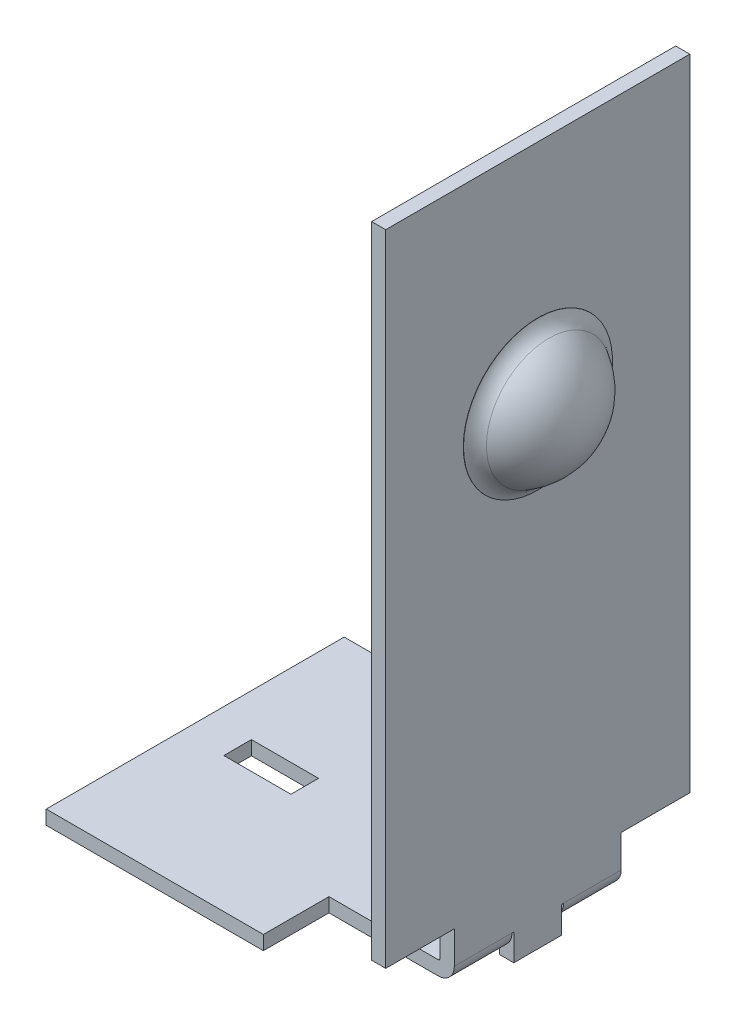
from build123d import *
from build123d.topology import SkipClean

# Parameters (mm, degrees)
Y_KSEKLIK_EKSTR_ZYON1_DEPTH = 3.24
IZIM2_W                     = 1.429951724
IZIM2_H                     = 0.588312172
KES_EKSTR_ZYON1_DEPTH       = 1.04186858
KES_EKSTR_ZYON2_DEPTH       = 0.5
Y_KSEKLIK_EKSTR_ZYON2_DEPTH = 0.3
IZIM7_R                     = 1.580293975
KES_EKSTR_ZYON3_DEPTH       = 0.3


with BuildPart() as part:
    # Çizim1 → Yükseklik-Ekstrüzyon1 (new, symmetric)
    with BuildSketch(Plane.XY):
        with BuildLine():
            Line((-0.3, 0.35), (-0.3, 14.676))
            Line((-0.3, 14.676), (0, 14.676))
            Line((0, 14.676), (0, 0.35))
            ThreePointArc((0, 0.35), (-0.102512627, 0.102512627), (-0.35, 0))
            Line((-0.35, 0), (-7.3, 0))
            Line((-7.3, 0), (-7.3, 0.3))
            Line((-7.3, 0.3), (-0.35, 0.3))
            ThreePointArc((-0.35, 0.3), (-0.314644661, 0.314644661), (-0.3, 0.35))
        make_face()
    extrude(amount=Y_KSEKLIK_EKSTR_ZYON1_DEPTH, both=True)

    # Çizim2 → Kes-Ekstrüzyon1 (cut)
    with BuildSketch(Plane(origin=(0, 0, 0), x_dir=(1, 0, 0), z_dir=(0, 1, 0))):
        Polygon((0, -4), (0, -1.778), (-2.671699332, -1.778), (-2.671699332, -3.175), (-7.3, -3.175), (-7.3, 3.175), (-2.671699332, 3.175), (-2.671699332, 1.778), (0, 1.778), (0, 4), (-8, 4), (-8, -4), align=None)
        with Locations((-5.68100521, 0)):
            Rectangle(IZIM2_W, IZIM2_H)
    extrude(amount=KES_EKSTR_ZYON1_DEPTH, mode=Mode.SUBTRACT)

    # Çizim4 → Kes-Ekstrüzyon2 (cut)
    with BuildSketch(Plane(origin=(0, 0, 0), x_dir=(0, 0, -1), z_dir=(1, 0, 0))):
        with BuildLine():
            Line((-0.55, -0.15), (0.55, -0.15))
            Line((0.55, -0.15), (0.55, 0.33))
            ThreePointArc((0.55, 0.33), (0.544142136, 0.344142136), (0.53, 0.35))
            Line((0.53, 0.35), (-0.53, 0.35))
            ThreePointArc((-0.53, 0.35), (-0.544142136, 0.344142136), (-0.55, 0.33))
            Line((-0.55, 0.33), (-0.55, -0.15))
        make_face()
    extrude(amount=-KES_EKSTR_ZYON2_DEPTH, mode=Mode.SUBTRACT)

    # Çizim5 → Yükseklik-Ekstrüzyon2 (add)
    with BuildSketch(Plane(origin=(0, 0, 0), x_dir=(0, 0, -1), z_dir=(1, 0, 0))):
        with BuildLine():
            Line((-0.51, -0.22), (0.51, -0.22))
            Line((0.51, -0.22), (0.51, 0.33))
            ThreePointArc((0.51, 0.33), (0.515857864, 0.344142136), (0.53, 0.35))
            Line((0.53, 0.35), (-0.53, 0.35))
            ThreePointArc((-0.53, 0.35), (-0.515857864, 0.344142136), (-0.51, 0.33))
            Line((-0.51, 0.33), (-0.51, -0.22))
        make_face()
    extrude(amount=-Y_KSEKLIK_EKSTR_ZYON2_DEPTH)

    # Çizim7 → Kes-Ekstrüzyon3 (cut)
    with BuildSketch(Plane(origin=(0, 0, 0), x_dir=(0, 0, -1), z_dir=(1, 0, 0))):
        with Locations((0, 9.847993975)):
            Circle(IZIM7_R)
    extrude(amount=-KES_EKSTR_ZYON3_DEPTH, mode=Mode.SUBTRACT)

    # Çizim6 → Döndür1 (revolve)
    with SkipClean():  # the faces are left unmerged after this step: merging them gives an invalid solid
        with BuildSketch(Plane.XY):
            with BuildLine():
                Line((0.716, 9.84078795), (1.0208, 9.84078795))
                ThreePointArc((1.0208, 9.84078795), (0.809273292, 10.612424612), (0.233830611, 11.168331447))
                ThreePointArc((0.233830611, 11.168331447), (0.096469293, 11.278181577), (0.0048, 11.42828795))
                Line((0.0048, 11.42828795), (-0.3, 11.42828795))
                ThreePointArc((-0.3, 11.42828795), (-0.294678979, 11.371583617), (-0.278901698, 11.316859108))
                ThreePointArc((-0.278901698, 11.316859108), (-0.132230828, 11.076688911), (0.08754728, 10.900928704))
                ThreePointArc((0.08754728, 10.900928704), (0.547080424, 10.456996364), (0.716, 9.84078795))
            make_face()
        revolve(axis=Axis((-0.492405336, 9.84078795, 0), (1, 0, 0)))


solid = part.part
